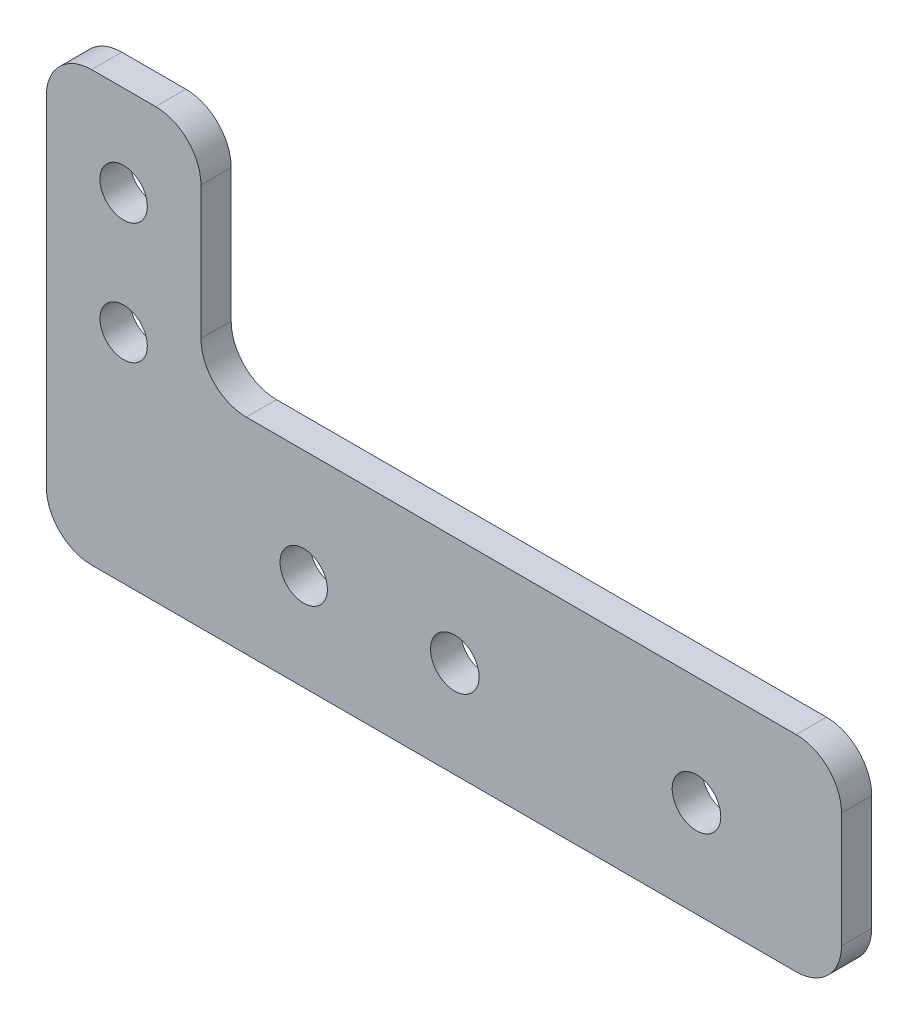
from build123d import *

# Parameters (mm, degrees)
SKETCH1_R           = 2.4892
SKETCH1_R_2         = 2.5527
BOSS_EXTRUDE1_DEPTH = 3.175
FILLET1_R           = 4.7625


with BuildPart() as part:
    # Sketch1 → Boss-Extrude1 (new body)
    with BuildSketch(Plane.XY):
        Polygon((-39.116, 23.8125), (-39.116, -21.2725), (44.45, -21.2725), (44.45, 0.3175), (-22.86, 0.3175), (-22.86, 23.8125), align=None)
        with Locations((-12.065, -11.1125)):
            Circle(SKETCH1_R, mode=Mode.SUBTRACT)
        with Locations((3.81, -11.1125)):
            Circle(SKETCH1_R_2, mode=Mode.SUBTRACT)
        with Locations((29.21, -11.1125)):
            Circle(SKETCH1_R_2, mode=Mode.SUBTRACT)
        with Locations((-30.988, 1.5875)):
            Circle(SKETCH1_R, mode=Mode.SUBTRACT)
        with Locations((-30.988, 14.2875)):
            Circle(SKETCH1_R, mode=Mode.SUBTRACT)
    extrude(amount=BOSS_EXTRUDE1_DEPTH)

    # Fillet1
    fillet1_edges = [part.edges().sort_by_distance(p)[0] for p in [
        (-39.116, 23.8125, 1.5875),
        (-22.86, 23.8125, 1.5875),
        (-22.86, 0.3175, 1.5875),
        (44.45, 0.3175, 1.5875),
        (44.45, -21.2725, 1.5875),
        (-39.116, -21.2725, 1.5875),
    ]]
    fillet(fillet1_edges, radius=FILLET1_R)


solid = part.part
